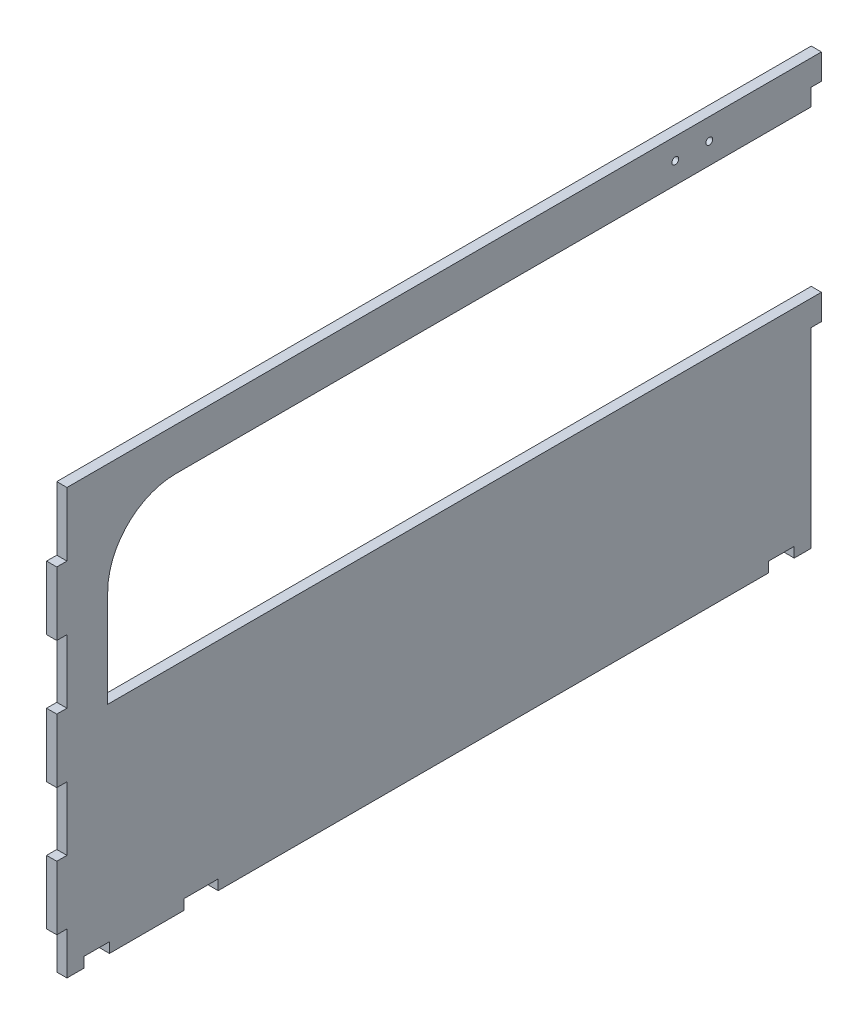
from build123d import *

# Parameters (mm, degrees)
BOSS_EXTRUDE1_DEPTH = 6
SKETCH2_W           = 6
SKETCH2_H           = 37.5
CUT_EXTRUDE1_DEPTH  = 6
LPATTERN1_COUNT     = 4
LPATTERN1_PITCH     = 75
FILLET1_R           = 40
SKETCH3_W           = 6
SKETCH3_H           = 10
SKETCH3_H_2         = 112.5
CUT_EXTRUDE2_DEPTH  = 515.816472153
SKETCH4_W           = 15
SKETCH4_H           = 6
CUT_EXTRUDE3_DEPTH  = 515.816472153
SKETCH5_R           = 2
CUT_EXTRUDE4_DEPTH  = 515.816472153
SKETCH6_W           = 20
SKETCH6_H           = 6
CUT_EXTRUDE5_DEPTH  = 515.816472153


with BuildPart() as part:
    # Sketch1 → Boss-Extrude1 (new body)
    with BuildSketch(Plane(origin=(0, 0, 0), x_dir=(0, 0, -1), z_dir=(1, 0, 0))):
        Polygon((450, 225), (450, 250), (0, 250), (0, 0), (450, 0), (450, 127.5), (30, 127.5), (30, 225), align=None)
    extrude(amount=BOSS_EXTRUDE1_DEPTH)

    # Sketch2 → Cut-Extrude1 (cut)
    with BuildSketch(Plane(origin=(6, 0, 0), x_dir=(0, 0, -1), z_dir=(1, 0, 0))):
        with Locations((3, 231.25)):
            Rectangle(SKETCH2_W, SKETCH2_H)
    cut_extrude1 = extrude(amount=-CUT_EXTRUDE1_DEPTH, mode=Mode.SUBTRACT)

    # LPattern1: Cut-Extrude1 ×4
    with Locations(*[(0, -i * LPATTERN1_PITCH, 0) for i in range(1, LPATTERN1_COUNT)]):
        add(cut_extrude1, mode=Mode.SUBTRACT)

    # Fillet1
    fillet1_edges = [part.edges().sort_by_distance(p)[0] for p in [
        (3, 225, -30),
    ]]
    fillet(fillet1_edges, radius=FILLET1_R)

    # Sketch3 → Cut-Extrude2 (cut, through all)
    with BuildSketch(Plane.ZY):
        with Locations((-447, 230)):
            Rectangle(SKETCH3_W, SKETCH3_H)
        with Locations((-447, 56.25)):
            Rectangle(SKETCH3_W, SKETCH3_H_2)
    extrude(amount=-CUT_EXTRUDE2_DEPTH, mode=Mode.SUBTRACT)

    # Sketch4 → Cut-Extrude3 (cut, through all)
    with BuildSketch(Plane.ZY):
        with Locations((-23.5, 3)):
            Rectangle(SKETCH4_W, SKETCH4_H)
        with Locations((-426.5, 3)):
            Rectangle(SKETCH4_W, SKETCH4_H)
    extrude(amount=-CUT_EXTRUDE3_DEPTH, mode=Mode.SUBTRACT)

    # Sketch5 → Cut-Extrude4 (cut, through all)
    with BuildSketch(Plane.ZY):
        with Locations((-384, 237.5)):
            Circle(SKETCH5_R)
        with Locations((-364, 237.5)):
            Circle(SKETCH5_R)
    extrude(amount=-CUT_EXTRUDE4_DEPTH, mode=Mode.SUBTRACT)

    # Sketch6 → Cut-Extrude5 (cut, through all)
    with BuildSketch(Plane.ZY):
        with Locations((-85, 3)):
            Rectangle(SKETCH6_W, SKETCH6_H)
    extrude(amount=-CUT_EXTRUDE5_DEPTH, mode=Mode.SUBTRACT)


solid = part.part
